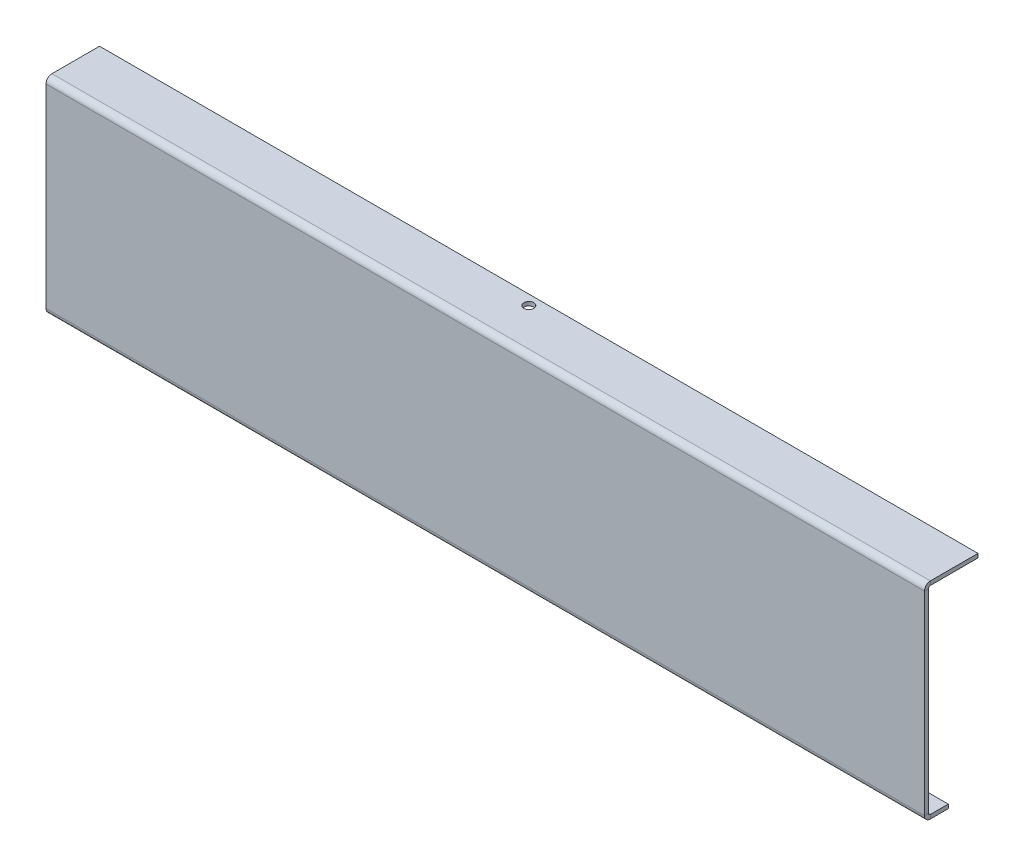
from build123d import *

# Parameters (mm, degrees)
SKETCH1_W                    = 443
SKETCH1_H                    = 100
BASE_FLANGE1_DEPTH           = 2
EDGE_FLANGE1_STRIP_W         = 10
EDGE_FLANGE1_STRIP_H         = 2
EDGE_FLANGE1_STRIP_CUT_DEPTH = 443
EDGE_FLANGE1_DEPTH           = 443
EDGE_FLANGE2_STRIP_W         = 10
EDGE_FLANGE2_STRIP_H         = 2
EDGE_FLANGE2_STRIP_CUT_DEPTH = 443
EDGE_FLANGE2_DEPTH           = 443
CUT_EXTRUDE2_DEPTH           = 10


# Sheet-metal steps are written as plain solids
with BuildPart() as part:
    # Sketch1 → Base-Flange1 (new body)
    with BuildSketch(Plane.XY):
        Rectangle(SKETCH1_W, SKETCH1_H)
    extrude(amount=-BASE_FLANGE1_DEPTH)

    # Edge-Flange1 strip (across the edge) → Edge-Flange1 strip cut (cut)
    with BuildSketch(Plane(origin=(-221.5, 50, -2), x_dir=(0, -1, 0), z_dir=(1, 0, 0))):
        with Locations((-4, -1)):
            Rectangle(EDGE_FLANGE1_STRIP_W, EDGE_FLANGE1_STRIP_H)
    extrude(amount=EDGE_FLANGE1_STRIP_CUT_DEPTH, mode=Mode.SUBTRACT)

    # Edge-Flange1 section (across the edge) → Edge-Flange1 (add)
    with BuildSketch(Plane(origin=(-221.5, 50, -2), x_dir=(0, -1, 0), z_dir=(1, 0, 0))):
        with BuildLine():
            Line((-2, 1), (-2, 25))
            Line((-2, 25), (0, 25))
            Line((0, 25), (0, 1))
            ThreePointArc((0, 1), (0.292893219, 0.292893219), (1, 0))
            Line((1, 0), (1, -2))
            ThreePointArc((1, -2), (-1.121320344, -1.121320344), (-2, 1))
        make_face()
    extrude(amount=EDGE_FLANGE1_DEPTH)

    # Edge-Flange2 strip (across the edge) → Edge-Flange2 strip cut (cut)
    with BuildSketch(Plane(origin=(221.5, -50, -2), x_dir=(0, 1, 0), z_dir=(-1, 0, 0))):
        with Locations((-4, -1)):
            Rectangle(EDGE_FLANGE2_STRIP_W, EDGE_FLANGE2_STRIP_H)
    extrude(amount=EDGE_FLANGE2_STRIP_CUT_DEPTH, mode=Mode.SUBTRACT)

    # Edge-Flange2 section (across the edge) → Edge-Flange2 (add)
    with BuildSketch(Plane(origin=(221.5, -50, -2), x_dir=(0, 1, 0), z_dir=(-1, 0, 0))):
        with BuildLine():
            Line((-2, 1), (-2, 10))
            Line((-2, 10), (0, 10))
            Line((0, 10), (0, 1))
            ThreePointArc((0, 1), (0.292893219, 0.292893219), (1, 0))
            Line((1, 0), (1, -2))
            ThreePointArc((1, -2), (-1.121320344, -1.121320344), (-2, 1))
        make_face()
    extrude(amount=EDGE_FLANGE2_DEPTH)

    # Sketch13 → Cut-Extrude2 (cut)
    with BuildSketch(Plane(origin=(0, 52, 0), x_dir=(1, 0, 0), z_dir=(0, 1, 0))):
        with BuildLine():
            ThreePointArc((0, 24.5), (-2.5, 22), (0, 19.5))
            Line((0, 19.5), (0, 24.5))
        make_face()
        with BuildLine():
            Line((0, 24.5), (0, 19.5))
            ThreePointArc((0, 19.5), (1.767766953, 20.232233047), (2.5, 22))
            ThreePointArc((2.5, 22), (1.767766953, 23.767766953), (0, 24.5))
        make_face()
    extrude(amount=-CUT_EXTRUDE2_DEPTH, mode=Mode.SUBTRACT)


solid = part.part
